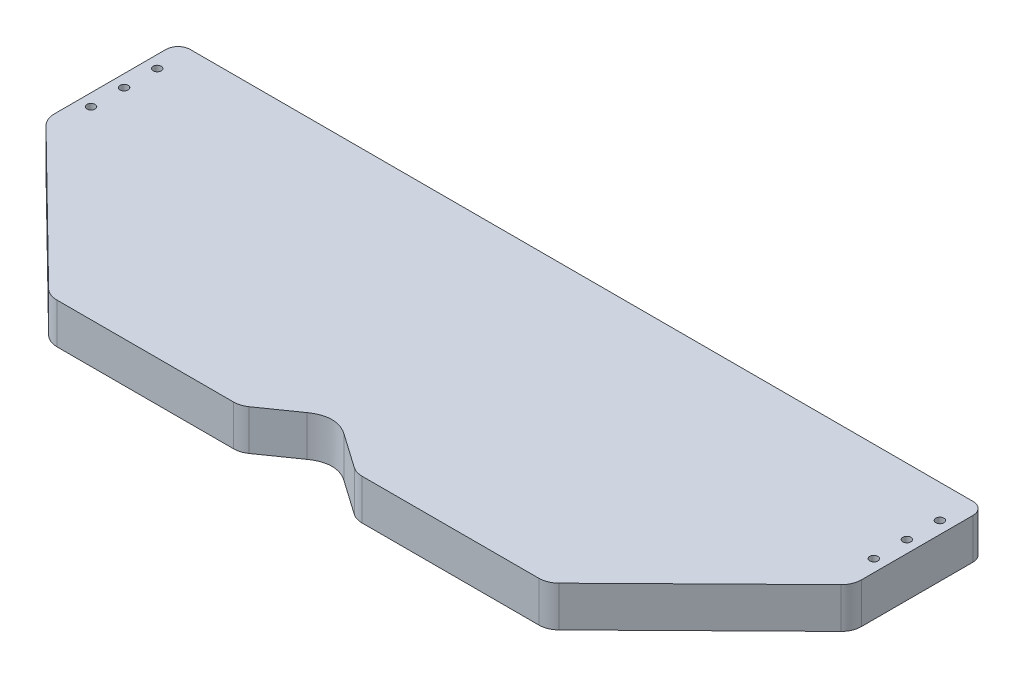
from build123d import *

# Parameters (mm, degrees)
SKETCH1_R           = 1
BOSS_EXTRUDE1_DEPTH = 5
FILLET1_R           = 5
FILLET2_R           = 5
FILLET3_R           = 5
FILLET4_R           = 3


with BuildPart() as part:
    # Sketch1 → Boss-Extrude1 (new, symmetric)
    with BuildSketch(Plane(origin=(0, 0, 0), x_dir=(1, 0, 0), z_dir=(0, 1, 0))):
        Polygon((0, -60), (-14.281480067, -70), (-61.501480067, -70), (-99.58, -32.62), (-99.58, 0), (99.58, 0), (99.58, -32.62), (61.501480067, -70), (14.281480067, -70), align=None)
        with Locations(Location((96.58, -8.16, 0), (0, 0, 270))):
            Circle(SKETCH1_R, mode=Mode.SUBTRACT)
        with Locations(Location((96.58, -16.32, 0), (0, 0, 270))):
            Circle(SKETCH1_R, mode=Mode.SUBTRACT)
        with Locations(Location((96.58, -24.48, 0), (0, 0, 270))):
            Circle(SKETCH1_R, mode=Mode.SUBTRACT)
        with Locations(Location((-96.58, -24.48, 0), (0, 0, 90))):
            Circle(SKETCH1_R, mode=Mode.SUBTRACT)
        with Locations(Location((-96.58, -16.32, 0), (0, 0, 90))):
            Circle(SKETCH1_R, mode=Mode.SUBTRACT)
        with Locations(Location((-96.58, -8.16, 0), (0, 0, 90))):
            Circle(SKETCH1_R, mode=Mode.SUBTRACT)
    extrude(amount=BOSS_EXTRUDE1_DEPTH, both=True)

    # Fillet1
    fillet1_edges = [part.edges().sort_by_distance(p)[0] for p in [
        (-14.281480067, 0, 70),
        (14.281480067, 0, 70),
    ]]
    fillet(fillet1_edges, radius=FILLET1_R)

    # Fillet2
    fillet2_edges = [part.edges().sort_by_distance(p)[0] for p in [
        (-61.501480067, 0, 70),
        (61.501480067, 0, 70),
    ]]
    fillet(fillet2_edges, radius=FILLET2_R)

    # Fillet3
    fillet3_edges = [part.edges().sort_by_distance(p)[0] for p in [
        (-99.58, 0, 32.62),
        (99.58, 0, 32.62),
    ]]
    fillet(fillet3_edges, radius=FILLET3_R)

    # Fillet4
    fillet4_edges = [part.edges().sort_by_distance(p)[0] for p in [
        (-99.58, 0, 0),
        (99.58, 0, 0),
    ]]
    fillet(fillet4_edges, radius=FILLET4_R)

    # Fillet5
    # a fillet whose section is not a circle: 8 mm, written as the material it adds along each edge
    with BuildSketch(Plane(origin=(0, -5, 60), x_dir=(-0.8191520442889911, 0, 0.5735764363510473), z_dir=(0, 1, 0))) as fillet5_piece_1:
        with BuildLine():
            Bezier((5.601660306, 0), (0, 0), (-1.915880661, 5.263838853), weights=[1, 1, 1])
            Line((-1.915880661, 5.263838853), (0, 0))
            Line((0, 0), (5.601660306, 0))
        make_face()
    extrude(amount=10)


solid = part.part
